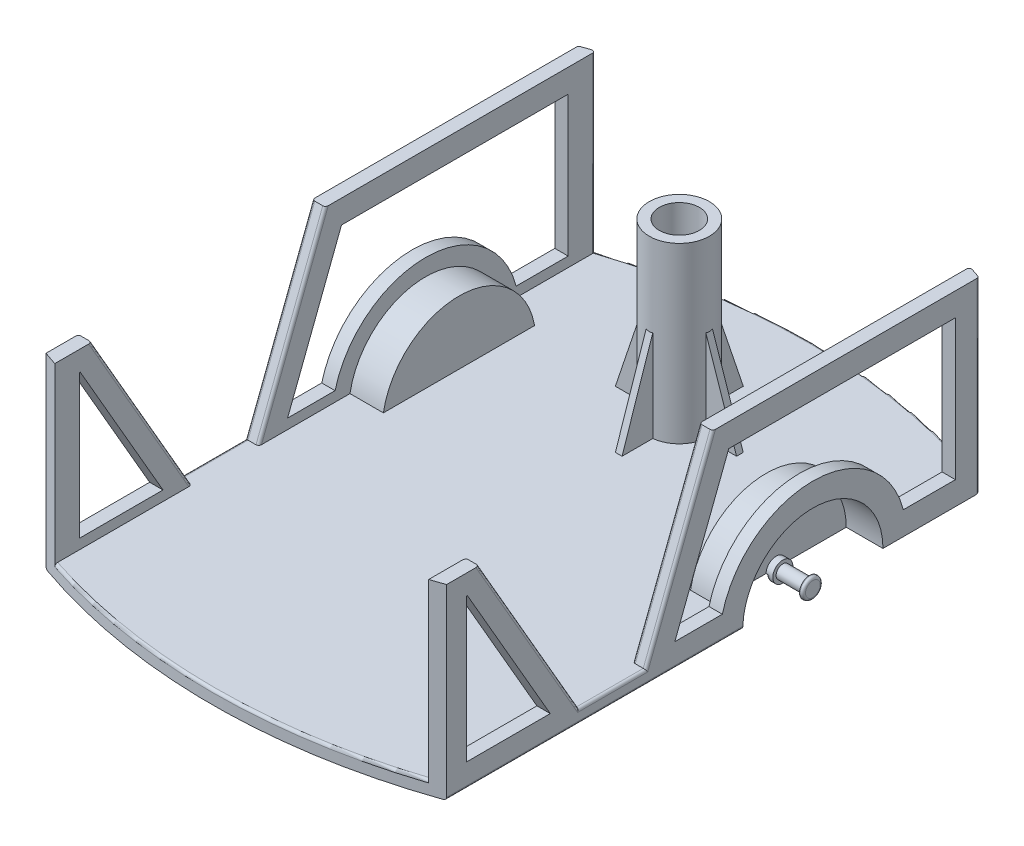
from build123d import *

# Parameters (mm, degrees)
EXTRUDE_505_DEPTH        = 300
EXTRUDE_505_DEPTH_BACK   = 300
CUT_EXTRUDE_START        = -55
SKETCH_3_R               = 105
SKETCH_3_R_2             = 10
CUT_EXTRUDE_710_DEPTH    = 55
SKETCH_4_R               = 15
EXTRUDE_1_DEPTH          = 5
EXTRUDE_START            = 10
SKETCH_5_R               = 15
EXTRUDE_2_DEPTH          = 10
SKETCH_7_W               = 2091.525423728
SKETCH_7_H               = 2000
CUT_EXTRUDE_3_DEPTH      = 742.097159622
CUT_EXTRUDE_4_DEPTH      = 230
CUT_EXTRUDE_4_DEPTH_BACK = 230
SKETCH_9_W               = 1200
SKETCH_9_H               = 400
CUT_EXTRUDE_5_DEPTH      = 280
CUT_EXTRUDE_5_DEPTH_BACK = 280
CUT_EXTRUDE_6_DEPTH      = 310
CUT_EXTRUDE_6_DEPTH_BACK = 310
CUT_EXTRUDE_7_DEPTH      = 700
CUT_EXTRUDE_8_DEPTH      = 700
SKETCH_16_R              = 45
SKETCH_16_R_2            = 30
EXTRUDE_4_DEPTH          = 260
EXTRUDE_8_DEPTH          = 5
PATTERN_CIRCULAR_1_COUNT = 4
SKETCH_18_R              = 30
EXTRUDE_6_DEPTH          = 10
FILLET_1_R               = 4
SKETCH_19_R              = 5
EXTRUDE_7_DEPTH          = 10


with BuildPart() as part:
    # 草图2 → Extrude 505 (new, two sides: drawn at the far end of the back side and taken through both)
    with BuildSketch(Plane(origin=(0, 0, 0), x_dir=(0, 0, -1), z_dir=(1, 0, 0)).offset(-EXTRUDE_505_DEPTH_BACK)):
        with BuildLine():
            Line((10, 0), (300, 0))
            Line((300, 0), (300, 300))
            Line((300, 300), (-600, 300))
            Line((-600, 300), (-600, 0))
            Line((-600, 0), (-10, 0))
            ThreePointArc((-10, 0), (0, -10), (10, 0))
        make_face()
    extrude(amount=EXTRUDE_505_DEPTH + EXTRUDE_505_DEPTH_BACK)

    # 草图3 → Cut-Extrude 710 (cut)
    with BuildSketch(Plane(origin=(300, 0, 0), x_dir=(0, 0, -1), z_dir=(1, 0, 0)).offset(CUT_EXTRUDE_START)):
        Circle(SKETCH_3_R)
        Circle(SKETCH_3_R_2, mode=Mode.SUBTRACT)
    cut_extrude_710 = extrude(amount=CUT_EXTRUDE_710_DEPTH, mode=Mode.SUBTRACT)

    # 草图4 → 轮胎固定1 (add)
    with BuildSketch(Plane(origin=(300, 0, 0), x_dir=(0, 0, -1), z_dir=(1, 0, 0))):
        Circle(SKETCH_4_R)
    extrude_1 = extrude(amount=-EXTRUDE_1_DEPTH)

    # 草图5 → 轮胎固定2 (add)
    with BuildSketch(Plane(origin=(245, 0, 0), x_dir=(0, 0, -1), z_dir=(1, 0, 0)).offset(EXTRUDE_START)):
        Circle(SKETCH_5_R)
    extrude_2 = extrude(amount=-EXTRUDE_2_DEPTH)

    # 镜向1: Cut-Extrude 710, 轮胎固定1, 轮胎固定2 across plane
    add(cut_extrude_710.mirror(Plane(origin=(0, 0, 0), x_dir=(0, 0, 1), z_dir=(1, 0, 0))), mode=Mode.SUBTRACT)
    add(extrude_1.mirror(Plane(origin=(0, 0, 0), x_dir=(0, 0, 1), z_dir=(1, 0, 0))))
    add(extrude_2.mirror(Plane(origin=(0, 0, 0), x_dir=(0, 0, 1), z_dir=(1, 0, 0))))

    # 草图7 → 切除-拉伸3 (cut, through all)
    with BuildSketch(Plane(origin=(0, 300, 0), x_dir=(1, 0, 0), z_dir=(0, 1, 0))):
        with Locations((0, -600)):
            Rectangle(SKETCH_7_W, SKETCH_7_H)
        with BuildLine():
            ThreePointArc((779.422863406, -150), (0, 300), (-779.422863406, -150))
            ThreePointArc((-779.422863406, -150), (0, -600), (779.422863406, -150))
        make_face(mode=Mode.SUBTRACT)
    extrude(amount=-CUT_EXTRUDE_3_DEPTH, mode=Mode.SUBTRACT)

    # 草图9 → 切除-拉伸4 (cut, two sides: drawn at the far end of the back side and taken through both)
    with BuildSketch(Plane(origin=(0, 0, 0), x_dir=(0, 0, -1), z_dir=(1, 0, 0)).offset(-CUT_EXTRUDE_4_DEPTH_BACK)):
        with Locations((-300, 220)):
            Rectangle(SKETCH_9_W, SKETCH_9_H)
    extrude(amount=CUT_EXTRUDE_4_DEPTH + CUT_EXTRUDE_4_DEPTH_BACK, mode=Mode.SUBTRACT)

    # 草图11 → 切除-拉伸5 (cut, two sides: drawn at the far end of the back side and taken through both)
    with BuildSketch(Plane(origin=(0, 0, 0), x_dir=(0, 0, -1), z_dir=(1, 0, 0)).offset(-CUT_EXTRUDE_5_DEPTH_BACK)):
        with BuildLine():
            Line((113.247516529, 20), (300, 20))
            Line((300, 20), (300, 400))
            Line((300, 400), (-900, 400))
            Line((-900, 400), (-900, 20))
            Line((-900, 20), (-113.247516529, 20))
            ThreePointArc((-113.247516529, 20), (0, 115), (113.247516529, 20))
        make_face()
    extrude(amount=CUT_EXTRUDE_5_DEPTH + CUT_EXTRUDE_5_DEPTH_BACK, mode=Mode.SUBTRACT)

    # 草图12 → 切除-拉伸6 (cut, two sides: drawn at the far end of the back side and taken through both)
    with BuildSketch(Plane(origin=(0, 0, 0), x_dir=(0, 0, -1), z_dir=(1, 0, 0)).offset(-CUT_EXTRUDE_6_DEPTH_BACK)):
        Polygon((300, 280), (-150, 280), (-250, 20), (-350, 20), (-500, 280), (-800, 280), (-800, 310), (300, 310), align=None)
    extrude(amount=CUT_EXTRUDE_6_DEPTH + CUT_EXTRUDE_6_DEPTH_BACK, mode=Mode.SUBTRACT)

    # 草图13 → 切除-拉伸7 (cut)
    with BuildSketch(Plane(origin=(300, 0, 0), x_dir=(0, 0, -1), z_dir=(1, 0, 0))):
        with BuildLine():
            Line((213.528137424, 35), (213.528137424, 245))
            Line((213.528137424, 245), (-125.962031561, 245))
            Line((-125.962031561, 245), (-206.731262331, 35))
            Line((-206.731262331, 35), (-135.554417117, 35))
            ThreePointArc((-135.554417117, 35), (0, 140), (135.554417117, 35))
            Line((135.554417117, 35), (213.528137424, 35))
        make_face()
    extrude(amount=-CUT_EXTRUDE_7_DEPTH, mode=Mode.SUBTRACT)

    # 草图14 → 切除-拉伸8 (cut)
    with BuildSketch(Plane(origin=(300, 0, 0), x_dir=(0, 0, -1), z_dir=(1, 0, 0))):
        Polygon((-518.528137424, 35), (-393.2884562, 35), (-517.326917738, 250), (-518.528137424, 250), align=None)
    extrude(amount=-CUT_EXTRUDE_8_DEPTH, mode=Mode.SUBTRACT)

    # 草图16 → 凸台-拉伸4 (add)
    with BuildSketch(Plane(origin=(0, 20, 0), x_dir=(1, 0, 0), z_dir=(0, 1, 0))):
        with Locations(Location((0, 100, 0), (0, 0, 270))):
            Circle(SKETCH_16_R)
        with Locations(Location((0, 100, 0), (0, 0, 270))):
            Circle(SKETCH_16_R_2, mode=Mode.SUBTRACT)
    extrude(amount=EXTRUDE_4_DEPTH)

    # 草图20 → 凸台-拉伸8 (add, symmetric)
    with BuildSketch(Plane(origin=(0, 0, 0), x_dir=(0, 0, -1), z_dir=(1, 0, 0))):
        Polygon((190.803173867, 20), (138.856506606, 174.599877041), (138.856506606, 20), align=None)
    extrude_8 = extrude(amount=EXTRUDE_8_DEPTH, both=True)

    # 阵列(圆周)1: 凸台-拉伸8 ×4 about axis
    pattern_circular_1_axis = Axis((0, 0, -100), (0, 1, 0))
    for i in range(1, PATTERN_CIRCULAR_1_COUNT):
        add(extrude_8.rotate(pattern_circular_1_axis, i * 360 / PATTERN_CIRCULAR_1_COUNT))

    # 草图18 → 凸台-拉伸6 (add)
    with BuildSketch(Plane.XZ):
        with Locations(Location((0, 400, 0), (0, 0, 270))):
            Circle(SKETCH_18_R)
    extrude(amount=EXTRUDE_6_DEPTH)

    # 圆角1
    # the kernel refuses this fillet: 4 mm, written as the material it takes off along each edge
    with BuildSketch(Plane(origin=(-300, 0, 558.528137424), x_dir=(1, 0, 0), z_dir=(0, 0, -1))) as fillet_1_piece_1:
        with BuildLine():
            CenterArc((FILLET_1_R, -FILLET_1_R), FILLET_1_R, 90, 90)
            Line((0, -FILLET_1_R), (0, 0))
            Line((0, 0), (FILLET_1_R, 0))
        make_face()
    extrude(amount=463.528137424, mode=Mode.SUBTRACT)
    with BuildSketch(Plane(origin=(300, 0, 558.528137424), x_dir=(-1, 0, 0), z_dir=(0, 0, -1))) as fillet_1_piece_2:
        with BuildLine():
            CenterArc((FILLET_1_R, FILLET_1_R), FILLET_1_R, 180, 90)
            Line((0, FILLET_1_R), (0, 0))
            Line((0, 0), (FILLET_1_R, 0))
        make_face()
    extrude(amount=463.528137424, mode=Mode.SUBTRACT)
    with BuildSketch(Plane(origin=(0, 20, 600), x_dir=(-0.32165208125736366, 0, -0.9468579294819294), z_dir=(-0.9468579294819294, -7.702585451301376e-15, 0.32165208125736366))) as fillet_1_piece_3_section:
        with BuildLine():
            CenterArc((900 - FILLET_1_R, FILLET_1_R), FILLET_1_R, 270, 90)
            Line((900 - FILLET_1_R, 0), (900, 0))
            Line((900, 0), (900, FILLET_1_R))
        make_face()
    fillet_1_piece_3 = revolve(axis=Axis((0, 20, 600), (0, -1, 0)), revolution_arc=37.525730433, mode=Mode.PRIVATE)
    fillet_1_piece_3 = split(fillet_1_piece_3, bisect_by=Plane(origin=(280, 20, 600), z_dir=(-1, 0, 0)), keep=Keep.TOP, mode=Mode.PRIVATE)
    fillet_1_piece_3 = split(fillet_1_piece_3, bisect_by=Plane(origin=(-280, 20, 600), z_dir=(1, 0, 0)), keep=Keep.TOP, mode=Mode.PRIVATE)
    add(fillet_1_piece_3, mode=Mode.SUBTRACT)
    with BuildSketch(Plane(origin=(-300, 20, 360), x_dir=(0, -1, 0), z_dir=(0, 0, -1))) as fillet_1_piece_4_section:
        with BuildLine():
            CenterArc((FILLET_1_R, -FILLET_1_R), FILLET_1_R, 90, 90)
            Line((0, -FILLET_1_R), (0, 0))
            Line((0, 0), (FILLET_1_R, 0))
        make_face()
    fillet_1_piece_4 = extrude(amount=120, mode=Mode.PRIVATE)
    fillet_1_piece_4 = split(fillet_1_piece_4, bisect_by=Plane(origin=(-300, -16.855670103, 264.175257732), z_dir=(0, 0.3589790793088687, 0.9333456062030597)), keep=Keep.TOP, mode=Mode.PRIVATE)
    fillet_1_piece_4 = split(fillet_1_piece_4, bisect_by=Plane(origin=(-300, 24.328523862, 352.497225305), z_dir=(0, 0.49972245348957695, -0.8661855860486006)), keep=Keep.TOP, mode=Mode.PRIVATE)
    add(fillet_1_piece_4, mode=Mode.SUBTRACT)
    with BuildSketch(Plane(origin=(300, 20, 360), x_dir=(0, -1, 0), z_dir=(0, 0, -1))) as fillet_1_piece_5_section:
        with BuildLine():
            CenterArc((FILLET_1_R, FILLET_1_R), FILLET_1_R, 180, 90)
            Line((0, FILLET_1_R), (0, 0))
            Line((0, 0), (FILLET_1_R, 0))
        make_face()
    fillet_1_piece_5 = extrude(amount=120, mode=Mode.PRIVATE)
    fillet_1_piece_5 = split(fillet_1_piece_5, bisect_by=Plane(origin=(300, -16.855670103, 264.175257732), z_dir=(0, 0.3589790793088687, 0.9333456062030597)), keep=Keep.TOP, mode=Mode.PRIVATE)
    fillet_1_piece_5 = split(fillet_1_piece_5, bisect_by=Plane(origin=(300, 24.328523862, 352.497225305), z_dir=(0, 0.49972245348957695, -0.8661855860486006)), keep=Keep.TOP, mode=Mode.PRIVATE)
    add(fillet_1_piece_5, mode=Mode.SUBTRACT)
    with BuildSketch(Plane(origin=(0, 0, 600), x_dir=(-0.34378898242827444, 0, -0.9390469293709083), z_dir=(-0.9390469293709083, -1.387693103422985e-15, 0.34378898242827444))) as fillet_1_piece_6:
        with BuildLine():
            CenterArc((900 - FILLET_1_R, -FILLET_1_R), FILLET_1_R, 360, 90)
            Line((900, -FILLET_1_R), (900, 0))
            Line((900, 0), (900 - FILLET_1_R, 0))
        make_face()
    revolve(axis=Axis((0, 0, 600), (0, -1, 0)), revolution_arc=40.215776551, mode=Mode.SUBTRACT)
    with BuildSketch(Plane(origin=(-300, -7.098684795, -248.528137424), x_dir=(0, 0, 1), z_dir=(0, 1, 0))) as fillet_1_piece_7:
        with BuildLine():
            CenterArc((2.833156949, 4), FILLET_1_R, 199.290454036, 70.709545964)
            ThreePointArc((-0.942267071, 2.678571429), (-0.472189888, 1.338914111), (0, 0))
            Line((0, 0), (2.833156949, 0))
        make_face()
    extrude(amount=294.19736959, mode=Mode.SUBTRACT)
    with BuildSketch(Plane(origin=(-280, 20, -255.336191214), x_dir=(-0.9494100204242153, 0, 0.3140391904175195), z_dir=(0, 1, 0))) as fillet_1_piece_8:
        with BuildLine():
            CenterArc((5.536228479, 3.999980996), FILLET_1_R, 161.697179654, 108.479436732)
            Line((1.738588398, 5.256137758), (0, 0))
            ThreePointArc((0, 0), (2.774279305, -0.004275913), (5.54855861, 0))
        make_face()
    extrude(amount=273.871396524, mode=Mode.SUBTRACT)
    with BuildSketch(Plane(origin=(280, 20, -255.336191214), x_dir=(0.9494100204242153, 0, 0.3140391904175195), z_dir=(0, 1, 0))) as fillet_1_piece_9:
        with BuildLine():
            CenterArc((5.536228479, -3.999980996), FILLET_1_R, 89.823383614, 108.479436732)
            Line((1.738588398, -5.256137758), (0, 0))
            ThreePointArc((0, 0), (2.774279305, 0.004275913), (5.54855861, 0))
        make_face()
    extrude(amount=273.871396524, mode=Mode.SUBTRACT)
    with BuildSketch(Plane(origin=(300, -7.098684795, -248.528137424), x_dir=(0, 0, 1), z_dir=(0, 1, 0))) as fillet_1_piece_10:
        with BuildLine():
            CenterArc((2.833156949, -4), FILLET_1_R, 90, 70.709545964)
            ThreePointArc((-0.942267071, -2.678571429), (-0.472189888, -1.338914111), (0, 0))
            Line((0, 0), (2.833156949, 0))
        make_face()
    extrude(amount=294.19736959, mode=Mode.SUBTRACT)
    with BuildSketch(Plane(origin=(245, 0, 0), x_dir=(0, 0, 1), z_dir=(0, 1, 0))) as fillet_1_piece_11:
        with BuildLine():
            CenterArc((15 - FILLET_1_R, FILLET_1_R), FILLET_1_R, 270, 90)
            Line((15 - FILLET_1_R, 0), (15, 0))
            Line((15, 0), (15, FILLET_1_R))
        make_face()
    revolve(axis=Axis((245, 0, 0), (1, 0, 0)), revolution_arc=180, mode=Mode.SUBTRACT)
    with BuildSketch(Plane(origin=(-245, 0, 0), x_dir=(0, 0, 1), z_dir=(0, 1, 0))) as fillet_1_piece_12:
        with BuildLine():
            CenterArc((15 - FILLET_1_R, -FILLET_1_R), FILLET_1_R, 0, 90)
            Line((15, -FILLET_1_R), (15, 0))
            Line((15, 0), (15 - FILLET_1_R, 0))
        make_face()
    revolve(axis=Axis((-245, 0, 0), (1, 0, 0)), revolution_arc=180, mode=Mode.SUBTRACT)
    with BuildSketch(Plane(origin=(-300, 0, 0), x_dir=(0, 0, -1), z_dir=(0, -1, 0))) as fillet_1_piece_13:
        with BuildLine():
            CenterArc((15 - FILLET_1_R, FILLET_1_R), FILLET_1_R, 270, 90)
            Line((15 - FILLET_1_R, 0), (15, 0))
            Line((15, 0), (15, FILLET_1_R))
        make_face()
    revolve(axis=Axis((-300, 0, 0), (1, 0, 0)), mode=Mode.SUBTRACT)
    with BuildSketch(Plane(origin=(300, 0, 0), x_dir=(0, 0, -1), z_dir=(0, -1, 0))) as fillet_1_piece_14:
        with BuildLine():
            CenterArc((15 - FILLET_1_R, -FILLET_1_R), FILLET_1_R, 0, 90)
            Line((15, -FILLET_1_R), (15, 0))
            Line((15, 0), (15 - FILLET_1_R, 0))
        make_face()
    revolve(axis=Axis((300, 0, 0), (1, 0, 0)), mode=Mode.SUBTRACT)
    with BuildSketch(Plane(origin=(-300, 288.66185586, 504.997224535), x_dir=(0, -0.4997224534895769, 0.8661855860486005), z_dir=(0, -0.8661855860486006, -0.49972245348957695))) as fillet_1_piece_15_section:
        with BuildLine():
            CenterArc((FILLET_1_R, -FILLET_1_R), FILLET_1_R, 90, 90)
            Line((0, -FILLET_1_R), (0, 0))
            Line((0, 0), (FILLET_1_R, 0))
        make_face()
    fillet_1_piece_15 = extrude(amount=320.166620396, mode=Mode.PRIVATE)
    fillet_1_piece_15 = split(fillet_1_piece_15, bisect_by=Plane(origin=(-300, 20, 504.997224535), z_dir=(0, 1, 0)), keep=Keep.TOP, mode=Mode.PRIVATE)
    add(fillet_1_piece_15, mode=Mode.SUBTRACT)
    with BuildSketch(Plane(origin=(-280, 288.66185586, 504.997224535), x_dir=(-1, 0, 0), z_dir=(0, -0.8661855860486006, -0.49972245348957695))) as fillet_1_piece_16_section:
        with BuildLine():
            CenterArc((FILLET_1_R, -FILLET_1_R), FILLET_1_R, 90, 90)
            Line((0, -FILLET_1_R), (0, 0))
            Line((0, 0), (FILLET_1_R, 0))
        make_face()
    fillet_1_piece_16 = extrude(amount=320.166620396, mode=Mode.PRIVATE)
    fillet_1_piece_16 = split(fillet_1_piece_16, bisect_by=Plane(origin=(-280, 20, 504.997224535), z_dir=(0, 1, 0)), keep=Keep.TOP, mode=Mode.PRIVATE)
    add(fillet_1_piece_16, mode=Mode.SUBTRACT)
    with BuildSketch(Plane(origin=(-300, 10.666543938, 253.589790793), x_dir=(0, -0.3589790793088687, -0.9333456062030598), z_dir=(0, 0.9333456062030597, -0.3589790793088687))) as fillet_1_piece_17_section:
        with BuildLine():
            CenterArc((FILLET_1_R, -FILLET_1_R), FILLET_1_R, 90, 90)
            Line((0, -FILLET_1_R), (0, 0))
            Line((0, 0), (FILLET_1_R, 0))
        make_face()
    fillet_1_piece_17 = extrude(amount=298.567765544, mode=Mode.PRIVATE)
    fillet_1_piece_17 = split(fillet_1_piece_17, bisect_by=Plane(origin=(-300, 20, 253.589790793), z_dir=(0, 1, 0)), keep=Keep.TOP, mode=Mode.PRIVATE)
    add(fillet_1_piece_17, mode=Mode.SUBTRACT)
    with BuildSketch(Plane(origin=(-280, 10.666543938, 253.589790793), x_dir=(-1, 0, 0), z_dir=(0, 0.9333456062030597, -0.3589790793088687))) as fillet_1_piece_18_section:
        with BuildLine():
            CenterArc((FILLET_1_R, -FILLET_1_R), FILLET_1_R, 90, 90)
            Line((0, -FILLET_1_R), (0, 0))
            Line((0, 0), (FILLET_1_R, 0))
        make_face()
    fillet_1_piece_18 = extrude(amount=298.567765544, mode=Mode.PRIVATE)
    fillet_1_piece_18 = split(fillet_1_piece_18, bisect_by=Plane(origin=(-280, 20, 253.589790793), z_dir=(0, 1, 0)), keep=Keep.TOP, mode=Mode.PRIVATE)
    add(fillet_1_piece_18, mode=Mode.SUBTRACT)
    with BuildSketch(Plane(origin=(280, 10.666543938, 253.589790793), x_dir=(1, 0, 0), z_dir=(0, 0.9333456062030597, -0.3589790793088687))) as fillet_1_piece_19_section:
        with BuildLine():
            CenterArc((FILLET_1_R, FILLET_1_R), FILLET_1_R, 180, 90)
            Line((0, FILLET_1_R), (0, 0))
            Line((0, 0), (FILLET_1_R, 0))
        make_face()
    fillet_1_piece_19 = extrude(amount=298.567765544, mode=Mode.PRIVATE)
    fillet_1_piece_19 = split(fillet_1_piece_19, bisect_by=Plane(origin=(280, 20, 253.589790793), z_dir=(0, 1, 0)), keep=Keep.TOP, mode=Mode.PRIVATE)
    add(fillet_1_piece_19, mode=Mode.SUBTRACT)
    with BuildSketch(Plane(origin=(300, 10.666543938, 253.589790793), x_dir=(0, -0.3589790793088687, -0.9333456062030598), z_dir=(0, 0.9333456062030597, -0.3589790793088687))) as fillet_1_piece_20_section:
        with BuildLine():
            CenterArc((FILLET_1_R, FILLET_1_R), FILLET_1_R, 180, 90)
            Line((0, FILLET_1_R), (0, 0))
            Line((0, 0), (FILLET_1_R, 0))
        make_face()
    fillet_1_piece_20 = extrude(amount=298.567765544, mode=Mode.PRIVATE)
    fillet_1_piece_20 = split(fillet_1_piece_20, bisect_by=Plane(origin=(300, 20, 253.589790793), z_dir=(0, 1, 0)), keep=Keep.TOP, mode=Mode.PRIVATE)
    add(fillet_1_piece_20, mode=Mode.SUBTRACT)
    with BuildSketch(Plane(origin=(280, 288.66185586, 504.997224535), x_dir=(0, -0.4997224534895769, 0.8661855860486005), z_dir=(0, -0.8661855860486006, -0.49972245348957695))) as fillet_1_piece_21_section:
        with BuildLine():
            CenterArc((FILLET_1_R, -FILLET_1_R), FILLET_1_R, 90, 90)
            Line((0, -FILLET_1_R), (0, 0))
            Line((0, 0), (FILLET_1_R, 0))
        make_face()
    fillet_1_piece_21 = extrude(amount=320.166620396, mode=Mode.PRIVATE)
    fillet_1_piece_21 = split(fillet_1_piece_21, bisect_by=Plane(origin=(280, 20, 504.997224535), z_dir=(0, 1, 0)), keep=Keep.TOP, mode=Mode.PRIVATE)
    add(fillet_1_piece_21, mode=Mode.SUBTRACT)
    with BuildSketch(Plane(origin=(300, 288.66185586, 504.997224535), x_dir=(0, -0.4997224534895769, 0.8661855860486005), z_dir=(0, -0.8661855860486006, -0.49972245348957695))) as fillet_1_piece_22_section:
        with BuildLine():
            CenterArc((FILLET_1_R, FILLET_1_R), FILLET_1_R, 180, 90)
            Line((0, FILLET_1_R), (0, 0))
            Line((0, 0), (FILLET_1_R, 0))
        make_face()
    fillet_1_piece_22 = extrude(amount=320.166620396, mode=Mode.PRIVATE)
    fillet_1_piece_22 = split(fillet_1_piece_22, bisect_by=Plane(origin=(300, 20, 504.997224535), z_dir=(0, 1, 0)), keep=Keep.TOP, mode=Mode.PRIVATE)
    add(fillet_1_piece_22, mode=Mode.SUBTRACT)
    with BuildSketch(Plane(origin=(0, 20, -300), x_dir=(0.32165208125736405, 0, 0.9468579294819293), z_dir=(0.9468579294819293, 7.702585451301357e-15, -0.32165208125736405))) as fillet_1_piece_23_section:
        with BuildLine():
            CenterArc((900 - FILLET_1_R, FILLET_1_R), FILLET_1_R, 270, 90)
            Line((900 - FILLET_1_R, 0), (900, 0))
            Line((900, 0), (900, FILLET_1_R))
        make_face()
    fillet_1_piece_23 = revolve(axis=Axis((0, 20, -300), (0, -1, 0)), revolution_arc=37.525730433, mode=Mode.PRIVATE)
    fillet_1_piece_23 = split(fillet_1_piece_23, bisect_by=Plane(origin=(-280, 20, -300), z_dir=(1, 0, 0)), keep=Keep.TOP, mode=Mode.PRIVATE)
    fillet_1_piece_23 = split(fillet_1_piece_23, bisect_by=Plane(origin=(280, 20, -300), z_dir=(-1, 0, 0)), keep=Keep.TOP, mode=Mode.PRIVATE)
    add(fillet_1_piece_23, mode=Mode.SUBTRACT)
    with BuildSketch(Plane(origin=(0, 20, 600), x_dir=(-0.32165208125736366, 0, -0.9468579294819294), z_dir=(-0.9468579294819294, -7.702585451301376e-15, 0.32165208125736366))) as fillet_1_piece_24a_section:
        with BuildLine():
            CenterArc((900 - FILLET_1_R, FILLET_1_R), FILLET_1_R, 270, 90)
            Line((900 - FILLET_1_R, 0), (900, 0))
            Line((900, 0), (900, FILLET_1_R))
        make_face()
    fillet_1_piece_24a = revolve(axis=Axis((0, 20, 600), (0, -1, 0)), revolution_arc=37.525730433, mode=Mode.PRIVATE)
    fillet_1_piece_24a = split(fillet_1_piece_24a, bisect_by=Plane(origin=(-280, 20, 600), z_dir=(-1, 0, 0)), keep=Keep.TOP, mode=Mode.PRIVATE)
    with BuildSketch(Plane(origin=(-280, 6.128603476, -255.336191214), x_dir=(-0.9494100204242153, 0, 0.3140391904175195), z_dir=(0, 1, 0))) as fillet_1_piece_24b_section:
        with BuildLine():
            CenterArc((5.536228479, 3.999980996), FILLET_1_R, 161.697179654, 108.479436732)
            Line((1.738588398, 5.256137758), (0, 0))
            ThreePointArc((0, 0), (2.774279305, -0.004275913), (5.54855861, 0))
        make_face()
    fillet_1_piece_24b = extrude(amount=273.871396524, mode=Mode.PRIVATE)
    fillet_1_piece_24b = split(fillet_1_piece_24b, bisect_by=Plane(origin=(-280, 20, -255.336191214), z_dir=(0, -1, 0)), keep=Keep.TOP, mode=Mode.PRIVATE)
    fillet_1_piece_24 = fillet_1_piece_24a & fillet_1_piece_24b
    add(fillet_1_piece_24, mode=Mode.SUBTRACT)
    with BuildSketch(Plane(origin=(280, 6.128603476, -255.336191214), x_dir=(0.9494100204242153, 0, 0.3140391904175195), z_dir=(0, 1, 0))) as fillet_1_piece_25a_section:
        with BuildLine():
            CenterArc((5.536228479, -3.999980996), FILLET_1_R, 89.823383614, 108.479436732)
            Line((1.738588398, -5.256137758), (0, 0))
            ThreePointArc((0, 0), (2.774279305, 0.004275913), (5.54855861, 0))
        make_face()
    fillet_1_piece_25a = extrude(amount=273.871396524, mode=Mode.PRIVATE)
    fillet_1_piece_25a = split(fillet_1_piece_25a, bisect_by=Plane(origin=(280, 20, -255.336191214), z_dir=(0, -1, 0)), keep=Keep.TOP, mode=Mode.PRIVATE)
    with BuildSketch(Plane(origin=(0, 20, 600), x_dir=(-0.32165208125736366, 0, -0.9468579294819294), z_dir=(-0.9468579294819294, -7.702585451301376e-15, 0.32165208125736366))) as fillet_1_piece_25b_section:
        with BuildLine():
            CenterArc((900 - FILLET_1_R, FILLET_1_R), FILLET_1_R, 270, 90)
            Line((900 - FILLET_1_R, 0), (900, 0))
            Line((900, 0), (900, FILLET_1_R))
        make_face()
    fillet_1_piece_25b = revolve(axis=Axis((0, 20, 600), (0, -1, 0)), revolution_arc=37.525730433, mode=Mode.PRIVATE)
    fillet_1_piece_25b = split(fillet_1_piece_25b, bisect_by=Plane(origin=(280, 20, 600), z_dir=(1, 0, 0)), keep=Keep.TOP, mode=Mode.PRIVATE)
    fillet_1_piece_25 = fillet_1_piece_25a & fillet_1_piece_25b
    add(fillet_1_piece_25, mode=Mode.SUBTRACT)
    with BuildSketch(Plane(origin=(-300, 288.66185586, 504.997224535), x_dir=(0, -0.4997224534895769, 0.8661855860486005), z_dir=(0, -0.8661855860486006, -0.49972245348957695))) as fillet_1_piece_26a_section:
        with BuildLine():
            CenterArc((FILLET_1_R, -FILLET_1_R), FILLET_1_R, 90, 90)
            Line((0, -FILLET_1_R), (0, 0))
            Line((0, 0), (FILLET_1_R, 0))
        make_face()
    fillet_1_piece_26a = extrude(amount=320.166620396, mode=Mode.PRIVATE)
    fillet_1_piece_26a = split(fillet_1_piece_26a, bisect_by=Plane(origin=(-300, 20, 504.997224535), z_dir=(0, -1, 0)), keep=Keep.TOP, mode=Mode.PRIVATE)
    with BuildSketch(Plane(origin=(-300, 20, 360), x_dir=(0, -1, 0), z_dir=(0, 0, -1))) as fillet_1_piece_26b_section:
        with BuildLine():
            CenterArc((FILLET_1_R, -FILLET_1_R), FILLET_1_R, 90, 90)
            Line((0, -FILLET_1_R), (0, 0))
            Line((0, 0), (FILLET_1_R, 0))
        make_face()
    fillet_1_piece_26b = extrude(amount=120, mode=Mode.PRIVATE)
    fillet_1_piece_26b = split(fillet_1_piece_26b, bisect_by=Plane(origin=(-300, 24.328523862, 352.497225305), z_dir=(0, -0.49972245348957695, 0.8661855860486006)), keep=Keep.TOP, mode=Mode.PRIVATE)
    fillet_1_piece_26 = fillet_1_piece_26a & fillet_1_piece_26b
    add(fillet_1_piece_26, mode=Mode.SUBTRACT)
    with BuildSketch(Plane(origin=(-300, 10.666543938, 253.589790793), x_dir=(0, -0.3589790793088687, -0.9333456062030598), z_dir=(0, 0.9333456062030597, -0.3589790793088687))) as fillet_1_piece_27a_section:
        with BuildLine():
            CenterArc((FILLET_1_R, -FILLET_1_R), FILLET_1_R, 90, 90)
            Line((0, -FILLET_1_R), (0, 0))
            Line((0, 0), (FILLET_1_R, 0))
        make_face()
    fillet_1_piece_27a = extrude(amount=298.567765544, mode=Mode.PRIVATE)
    fillet_1_piece_27a = split(fillet_1_piece_27a, bisect_by=Plane(origin=(-300, 20, 253.589790793), z_dir=(0, -1, 0)), keep=Keep.TOP, mode=Mode.PRIVATE)
    with BuildSketch(Plane(origin=(-300, 20, 360), x_dir=(0, -1, 0), z_dir=(0, 0, -1))) as fillet_1_piece_27b_section:
        with BuildLine():
            CenterArc((FILLET_1_R, -FILLET_1_R), FILLET_1_R, 90, 90)
            Line((0, -FILLET_1_R), (0, 0))
            Line((0, 0), (FILLET_1_R, 0))
        make_face()
    fillet_1_piece_27b = extrude(amount=120, mode=Mode.PRIVATE)
    fillet_1_piece_27b = split(fillet_1_piece_27b, bisect_by=Plane(origin=(-300, -16.855670103, 264.175257732), z_dir=(0, -0.3589790793088687, -0.9333456062030597)), keep=Keep.TOP, mode=Mode.PRIVATE)
    fillet_1_piece_27 = fillet_1_piece_27a & fillet_1_piece_27b
    add(fillet_1_piece_27, mode=Mode.SUBTRACT)
    with BuildSketch(Plane(origin=(300, 288.66185586, 504.997224535), x_dir=(0, -0.4997224534895769, 0.8661855860486005), z_dir=(0, -0.8661855860486006, -0.49972245348957695))) as fillet_1_piece_28a_section:
        with BuildLine():
            CenterArc((FILLET_1_R, FILLET_1_R), FILLET_1_R, 180, 90)
            Line((0, FILLET_1_R), (0, 0))
            Line((0, 0), (FILLET_1_R, 0))
        make_face()
    fillet_1_piece_28a = extrude(amount=320.166620396, mode=Mode.PRIVATE)
    fillet_1_piece_28a = split(fillet_1_piece_28a, bisect_by=Plane(origin=(300, 20, 504.997224535), z_dir=(0, -1, 0)), keep=Keep.TOP, mode=Mode.PRIVATE)
    with BuildSketch(Plane(origin=(300, 20, 360), x_dir=(0, -1, 0), z_dir=(0, 0, -1))) as fillet_1_piece_28b_section:
        with BuildLine():
            CenterArc((FILLET_1_R, FILLET_1_R), FILLET_1_R, 180, 90)
            Line((0, FILLET_1_R), (0, 0))
            Line((0, 0), (FILLET_1_R, 0))
        make_face()
    fillet_1_piece_28b = extrude(amount=120, mode=Mode.PRIVATE)
    fillet_1_piece_28b = split(fillet_1_piece_28b, bisect_by=Plane(origin=(300, 24.328523862, 352.497225305), z_dir=(0, -0.49972245348957695, 0.8661855860486006)), keep=Keep.TOP, mode=Mode.PRIVATE)
    fillet_1_piece_28 = fillet_1_piece_28a & fillet_1_piece_28b
    add(fillet_1_piece_28, mode=Mode.SUBTRACT)
    with BuildSketch(Plane(origin=(300, 10.666543938, 253.589790793), x_dir=(0, -0.3589790793088687, -0.9333456062030598), z_dir=(0, 0.9333456062030597, -0.3589790793088687))) as fillet_1_piece_29a_section:
        with BuildLine():
            CenterArc((FILLET_1_R, FILLET_1_R), FILLET_1_R, 180, 90)
            Line((0, FILLET_1_R), (0, 0))
            Line((0, 0), (FILLET_1_R, 0))
        make_face()
    fillet_1_piece_29a = extrude(amount=298.567765544, mode=Mode.PRIVATE)
    fillet_1_piece_29a = split(fillet_1_piece_29a, bisect_by=Plane(origin=(300, 20, 253.589790793), z_dir=(0, -1, 0)), keep=Keep.TOP, mode=Mode.PRIVATE)
    with BuildSketch(Plane(origin=(300, 20, 360), x_dir=(0, -1, 0), z_dir=(0, 0, -1))) as fillet_1_piece_29b_section:
        with BuildLine():
            CenterArc((FILLET_1_R, FILLET_1_R), FILLET_1_R, 180, 90)
            Line((0, FILLET_1_R), (0, 0))
            Line((0, 0), (FILLET_1_R, 0))
        make_face()
    fillet_1_piece_29b = extrude(amount=120, mode=Mode.PRIVATE)
    fillet_1_piece_29b = split(fillet_1_piece_29b, bisect_by=Plane(origin=(300, -16.855670103, 264.175257732), z_dir=(0, -0.3589790793088687, -0.9333456062030597)), keep=Keep.TOP, mode=Mode.PRIVATE)
    fillet_1_piece_29 = fillet_1_piece_29a & fillet_1_piece_29b
    add(fillet_1_piece_29, mode=Mode.SUBTRACT)

    # 草图19 → 凸台-拉伸7 (add)
    with BuildSketch(Plane.XZ.offset(10)):
        with Locations(Location((0, 400, 0), (0, 0, 270))):
            Circle(SKETCH_19_R)
    extrude(amount=EXTRUDE_7_DEPTH)


solid = part.part
